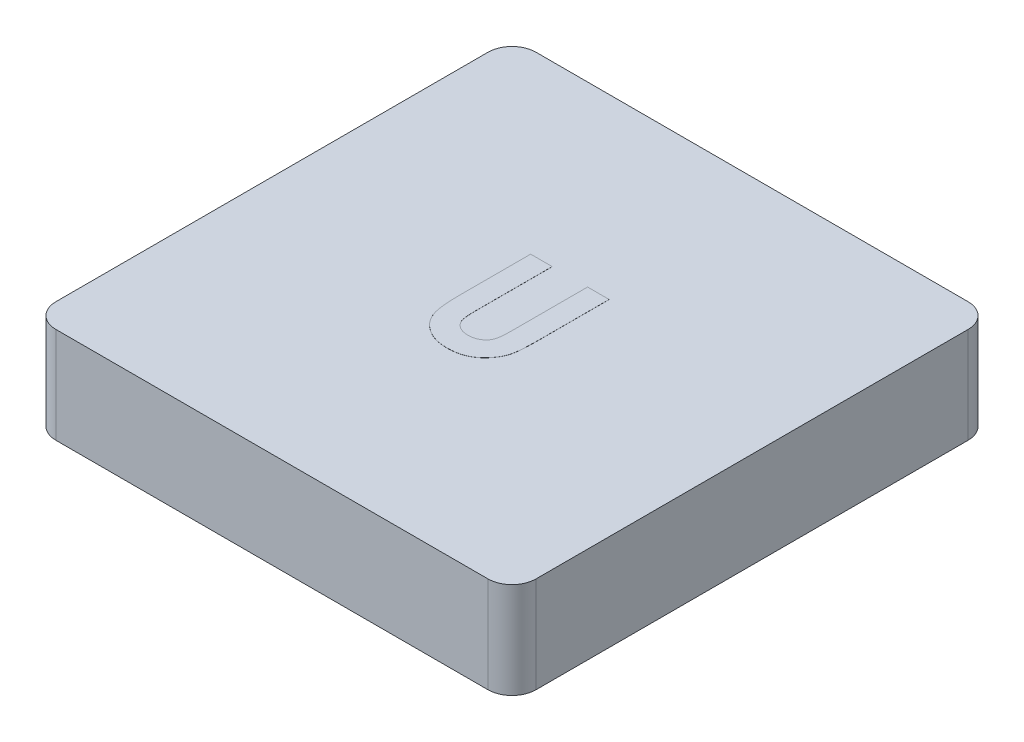
from build123d import *

# Parameters (mm, degrees)
SKETCH1_W           = 12.7
SKETCH1_H           = 12.7
BOSS_EXTRUDE1_DEPTH = 2.54
FILLET1_R           = 0.635
SHELL1_START        = 0.635
SHELL1_OUTLINE_W    = 1.905
SHELL1_OUTLINE_H    = 11.43
SHELL1_DEPTH        = 11.43
SKETCH2_R           = 2.54
BOSS_EXTRUDE2_DEPTH = 1.905
BOSS_EXTRUDE3_DEPTH = 0.00254


# Read off the part's stored shape, not the designer's step: Shell1
with BuildPart() as part:
    # Sketch1 → Boss-Extrude1 (new body)
    with BuildSketch(Plane(origin=(0, 0, 0), x_dir=(1, 0, 0), z_dir=(0, 1, 0))):
        with Locations((6.35, 6.35)):
            Rectangle(SKETCH1_W, SKETCH1_H)
    extrude(amount=BOSS_EXTRUDE1_DEPTH)

    # Fillet1
    fillet1_edges = [part.edges().sort_by_distance(p)[0] for p in [
        (0, 1.27, -12.7),
        (12.7, 1.27, -12.7),
        (12.7, 1.27, 0),
        (0, 1.27, 0),
    ]]
    fillet(fillet1_edges, radius=FILLET1_R)

    # Shell1 outline → Shell1 (cut)
    with BuildSketch(Plane.YZ.offset(SHELL1_START)):
        with Locations((0.9525, -6.35)):
            Rectangle(SHELL1_OUTLINE_W, SHELL1_OUTLINE_H)
    extrude(amount=SHELL1_DEPTH, mode=Mode.SUBTRACT)

    # Sketch2 → Boss-Extrude2 (add)
    with BuildSketch(Plane(origin=(0, 1.905, 0), x_dir=(-1, 0, 0), z_dir=(0, -1, 0))):
        with Locations(Location((-6.35, 6.35, 0), (0, 0, 270))):
            Circle(SKETCH2_R)
    extrude(amount=BOSS_EXTRUDE2_DEPTH)

    # Sketch3 → Boss-Extrude3 (add)
    with BuildSketch(Plane(origin=(0, 2.54, 0), x_dir=(1, 0, 0), z_dir=(0, 1, 0))):
        with BuildLine():
            Line((5.192346154, 8.001), (5.762217949, 8.001))
            Line((5.762217949, 8.001), (5.762217949, 5.935214744))
            add(Edge.make_bspline(
                [(5.762217949, 5.935214744), (5.762248936, 5.913797578), (5.762308786, 5.872430544), (5.765304944, 5.813082394), (5.768046636, 5.758529018), (5.772993425, 5.70883014), (5.780301528, 5.663964501), (5.787378157, 5.6236439), (5.796955674, 5.588590232), (5.811349151, 5.54868998), (5.833524775, 5.503859868), (5.869758513, 5.457136896), (5.911569146, 5.414495403), (5.961681599, 5.37900224), (6.018003565, 5.35029147), (6.080225578, 5.329019967), (6.148259929, 5.317195835), (6.195301951, 5.315390665), (6.219514623, 5.314461538)],
                knots=[0, 0, 0, 0, 1.155499968, 2.231836252, 3.205919964, 4.102923608, 4.924856345, 5.658536265, 6.31071849, 6.882491295, 7.94666036, 8.992281882, 10.060072772, 11.158554251, 12.289267114, 13.461410017, 14.693379945, 16, 16, 16, 16], degree=3))
            add(Edge.make_bspline(
                [(6.219514623, 5.314461538), (6.2452376, 5.315212154), (6.29539305, 5.316675726), (6.367533681, 5.331042272), (6.434372384, 5.353918735), (6.494493956, 5.386569277), (6.547838568, 5.425706674), (6.592993664, 5.47033557), (6.628629899, 5.520544979), (6.651856272, 5.566866983), (6.664896736, 5.609502353), (6.674671214, 5.647595439), (6.681836988, 5.692541509), (6.688338013, 5.743638634), (6.692244628, 5.801416082), (6.696480716, 5.865409199), (6.698033281, 5.936055843), (6.698297904, 5.985248427), (6.698435897, 6.010900841)],
                knots=[0, 0, 0, 0, 1.261321664, 2.459363699, 3.594844139, 4.716940403, 5.803436589, 6.833651888, 7.818396249, 8.814403945, 9.360733334, 10.004355033, 10.743453831, 11.592799886, 12.532235708, 13.585170094, 14.740740724, 16, 16, 16, 16], degree=3))
            Line((6.698435897, 6.010900841), (6.698435897, 8.001))
            Line((6.698435897, 8.001), (7.268307692, 8.001))
            Line((7.268307692, 8.001), (7.268307692, 6.106939503))
            add(Edge.make_bspline(
                [(7.268307692, 6.106939503), (7.268228555, 6.068565928), (7.268076382, 5.994777286), (7.265739466, 5.888737813), (7.260764595, 5.791887765), (7.256586276, 5.704198842), (7.2484998, 5.625789174), (7.240075588, 5.55632393), (7.229338205, 5.49604928), (7.213361625, 5.427433916), (7.185790778, 5.348425837), (7.141342957, 5.257451459), (7.084919326, 5.168382033), (7.018229414, 5.082197383), (6.942930403, 5.00213462), (6.860691833, 4.931849878), (6.772820271, 4.872396565), (6.678397522, 4.825228387), (6.577503944, 4.788440763), (6.469141271, 4.763721333), (6.353383397, 4.747020576), (6.273427246, 4.745416263), (6.232234976, 4.744589744)],
                knots=[0, 0, 0, 0, 1.170808336, 2.251350247, 3.235597562, 4.129743112, 4.929140599, 5.639994148, 6.264258765, 6.79612947, 7.788252245, 8.809469599, 9.879094798, 10.999557536, 12.129761673, 13.226370002, 14.293821979, 15.358369427, 16.438775801, 17.562147481, 18.744053101, 20, 20, 20, 20], degree=3))
            add(Edge.make_bspline(
                [(6.232234976, 4.744589744), (6.204866012, 4.745050738), (6.150867608, 4.745960269), (6.071453481, 4.753979964), (5.994684128, 4.765797979), (5.920703797, 4.783039245), (5.849255717, 4.80531174), (5.780358869, 4.832727631), (5.714269291, 4.865133995), (5.65135681, 4.902232764), (5.591698847, 4.942348696), (5.537174548, 4.986818895), (5.485907605, 5.032354622), (5.439379097, 5.080872214), (5.397239555, 5.131862319), (5.359575764, 5.185440497), (5.326443681, 5.24160199), (5.297009886, 5.301359104), (5.27181743, 5.367749078), (5.250579243, 5.443133431), (5.232025064, 5.528693737), (5.218236692, 5.624622759), (5.205736074, 5.730604326), (5.197823871, 5.846914536), (5.193684642, 5.973556726), (5.19280359, 6.061355131), (5.192346154, 6.106939503)],
                knots=[0, 0, 0, 0, 1.001158378, 1.975264943, 2.917723546, 3.841610987, 4.75185031, 5.653588123, 6.552117133, 7.442167995, 8.324307438, 9.179605724, 10.014504199, 10.831958861, 11.636465792, 12.43274043, 13.225645099, 14.020104002, 14.867201867, 15.819789774, 16.883317127, 18.068162734, 19.364263498, 20.787406516, 22.332041935, 24, 24, 24, 24], degree=3))
            Line((5.192346154, 6.106939503), (5.192346154, 8.001))
        make_face()
    extrude(amount=BOSS_EXTRUDE3_DEPTH)


solid = part.part
